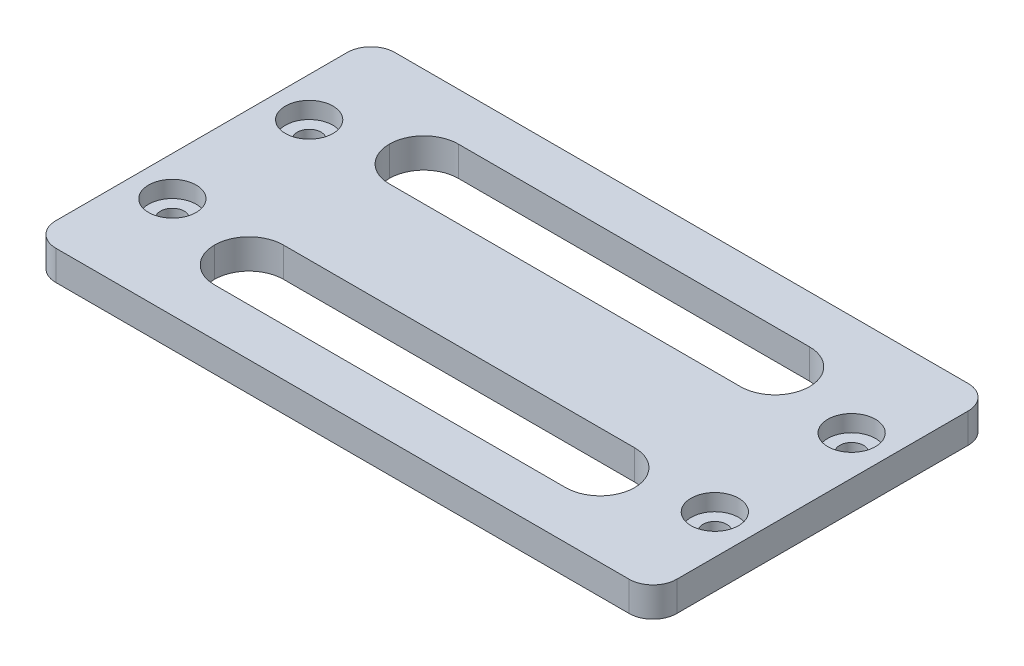
from build123d import *

# Parameters (mm, degrees)
SKETCH1_W           = 52.2
SKETCH1_H           = 28.5
SKETCH1_R           = 1
SKETCH1_W_2         = 35.320636832
SKETCH1_H_2         = 5.8
BOSS_EXTRUDE1_DEPTH = 2.5
FILLET1_R           = 2
FILLET2_R           = 2.9
SKETCH4_R           = 2
CUT_EXTRUDE1_DEPTH  = 1.4


with BuildPart() as part:
    # Sketch1 → Boss-Extrude1 (new body)
    with BuildSketch(Plane(origin=(0, 0, 0), x_dir=(1, 0, 0), z_dir=(0, 1, 0))):
        with Locations((0, 2.55)):
            Rectangle(SKETCH1_W, SKETCH1_H)
        with Locations(Location((-22.8, -3.2, 0), (0, 0, 270))):
            Circle(SKETCH1_R, mode=Mode.SUBTRACT)
        with Locations(Location((22.8, -3.2, 0), (0, 0, 90))):
            Circle(SKETCH1_R, mode=Mode.SUBTRACT)
        with Locations(Location((22.8, 8.3, 0), (0, 0, 270))):
            Circle(SKETCH1_R, mode=Mode.SUBTRACT)
        with Locations(Location((-22.8, 8.3, 0), (0, 0, 90))):
            Circle(SKETCH1_R, mode=Mode.SUBTRACT)
        with Locations((0, -4.8)):
            Rectangle(SKETCH1_W_2, SKETCH1_H_2, mode=Mode.SUBTRACT)
        with Locations((0, 9.9)):
            Rectangle(SKETCH1_W_2, SKETCH1_H_2, mode=Mode.SUBTRACT)
    extrude(amount=BOSS_EXTRUDE1_DEPTH)

    # Fillet1
    fillet1_edges = [part.edges().sort_by_distance(p)[0] for p in [
        (26.1, 1.25, 11.7),
        (-26.1, 1.25, 11.7),
        (-26.1, 1.25, -16.8),
        (26.1, 1.25, -16.8),
    ]]
    fillet(fillet1_edges, radius=FILLET1_R)

    # Fillet2
    fillet2_edges = [part.edges().sort_by_distance(p)[0] for p in [
        (17.660318416, 1.25, -7),
        (17.660318416, 1.25, -12.8),
        (17.660318416, 1.25, 7.7),
        (17.660318416, 1.25, 1.9),
        (-17.660318416, 1.25, 7.7),
        (-17.660318416, 1.25, 1.9),
        (-17.660318416, 1.25, -7),
        (-17.660318416, 1.25, -12.8),
    ]]
    fillet(fillet2_edges, radius=FILLET2_R - 0.0001)  # a hair under: the kernel refuses the full size

    # Sketch4 → Cut-Extrude1 (cut)
    with BuildSketch(Plane(origin=(0, 2.5, 0), x_dir=(1, 0, 0), z_dir=(0, 1, 0))):
        with Locations(Location((-22.8, 8.3, 0), (0, 0, 270))):
            Circle(SKETCH4_R)
        with Locations(Location((-22.8, -3.2, 0), (0, 0, 270))):
            Circle(SKETCH4_R)
        with Locations(Location((22.8, -3.2, 0), (0, 0, 270))):
            Circle(SKETCH4_R)
        with Locations(Location((22.8, 8.3, 0), (0, 0, 270))):
            Circle(SKETCH4_R)
    extrude(amount=-CUT_EXTRUDE1_DEPTH, mode=Mode.SUBTRACT)


solid = part.part
